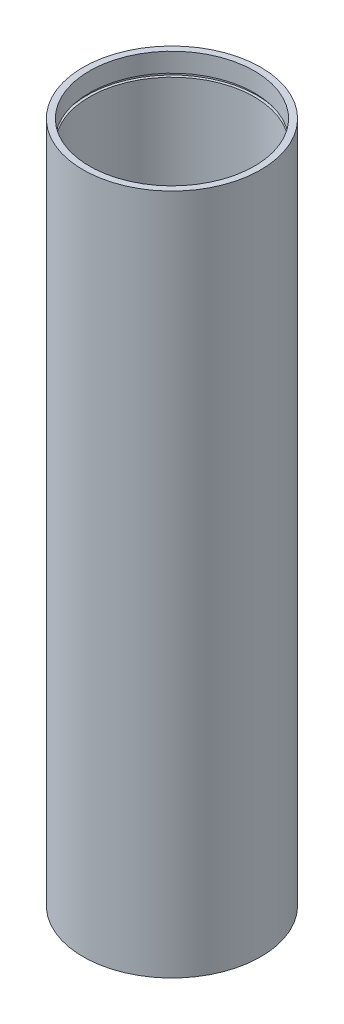
from build123d import *


with BuildPart() as part:
    # Sketch2 → Revolve1 (revolve)
    with BuildSketch(Plane.XY):
        Polygon((41.275, 329.692), (41.275, 11.2522), (42.5958, 11.2522), (42.5958, 9.525), (41.275, 9.525), (41.275, 0), (44.45, 0), (44.45, 340.9442), (41.275, 340.9442), (41.275, 331.4192), (42.5958, 331.4192), (42.5958, 329.692), align=None)
    revolve(axis=Axis((0, 0, 0), (0, 1, 0)))


solid = part.part
